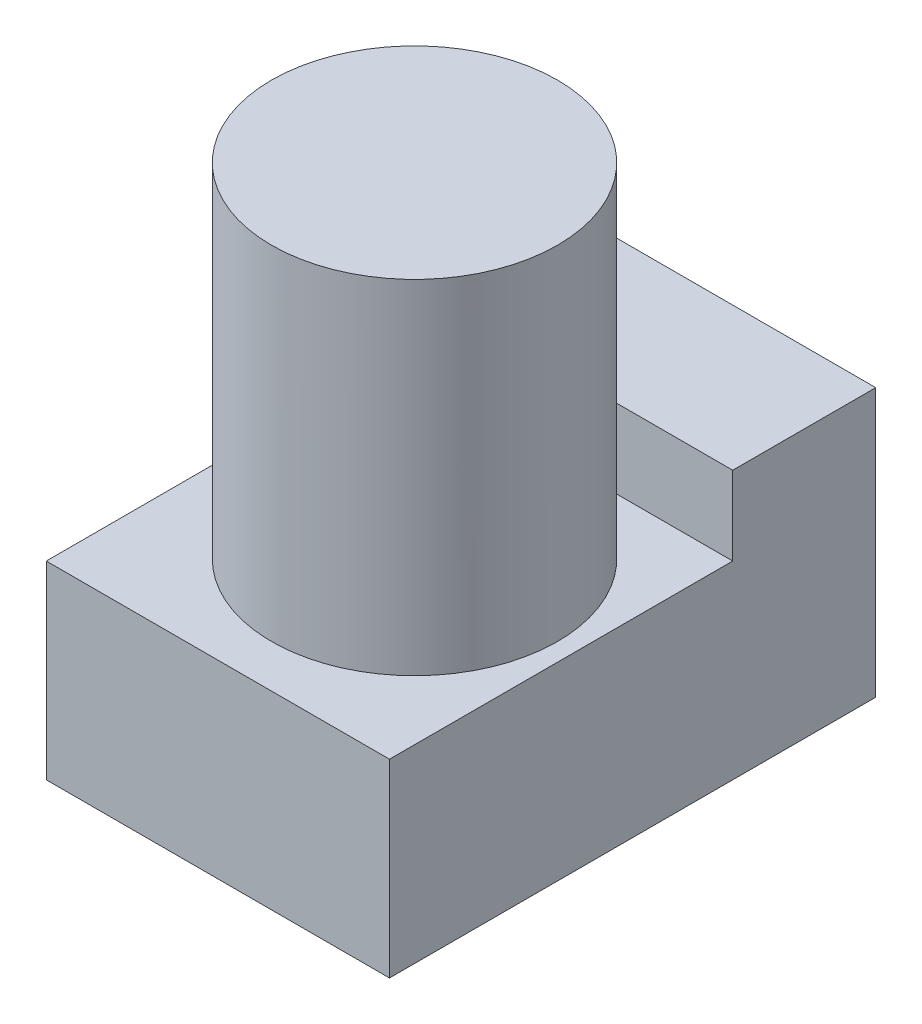
from build123d import *

# Parameters (mm, degrees)
BOSS_EXTRUDE1_DEPTH = 96
SKETCH2_R           = 40
BOSS_EXTRUDE2_DEPTH = 96


with BuildPart() as part:
    # Sketch1 → Boss-Extrude1 (new body)
    with BuildSketch(Plane(origin=(0, 0, 0), x_dir=(0, 0, -1), z_dir=(1, 0, 0))):
        Polygon((-101.449299301, -56.403624436), (34.550700699, -56.403624436), (34.550700699, -3.403624436), (34.550700699, 18.596375564), (-5.449299301, 18.596375564), (-5.449299301, -3.403624436), (-101.449299301, -3.403624436), align=None)
    extrude(amount=BOSS_EXTRUDE1_DEPTH)

    # Sketch2 → Boss-Extrude2 (add)
    with BuildSketch(Plane(origin=(0, -3.403624436, 0), x_dir=(1, 0, 0), z_dir=(0, 1, 0))):
        with Locations((51, -49.449299301)):
            Circle(SKETCH2_R)
    extrude(amount=BOSS_EXTRUDE2_DEPTH)


solid = part.part
